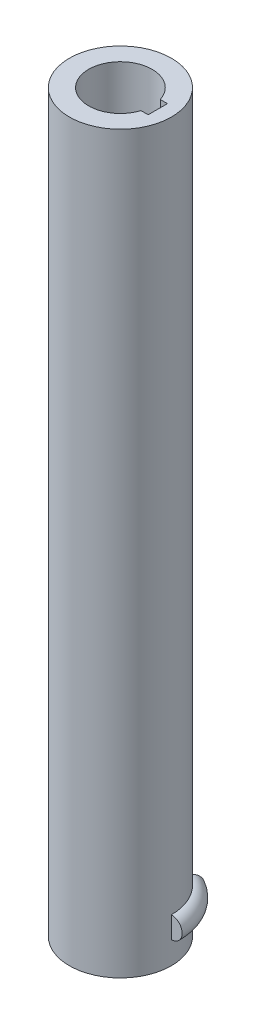
from build123d import *

# Parameters (mm, degrees)
REVOLVE_THIN1_ANGLE = 60
SKETCH3_R           = 45
BOSS_EXTRUDE2_DEPTH = 648.5
SKETCH4_R           = 28
CUT_EXTRUDE1_DEPTH  = 40
CUT_EXTRUDE2_DEPTH  = 40


# Read off the part's stored shape, not the designer's step: Revolve-Thin1
with BuildPart() as part:
    # Revolve-Thin1 outline → Revolve-Thin1 (revolve)
    with BuildSketch(Plane(origin=(-45, 0, 0), x_dir=(1, 0, 0), z_dir=(0, 0, 1))):
        with BuildLine():
            Line((35, -19.5), (0, -19.5))
            Line((0, -19.5), (0, -29.5))
            Line((0, -29.5), (45, -29.5))
            Line((45, -29.5), (45, -9.5))
            ThreePointArc((45, -9.5), (54.5, 0), (45, 9.5))
            Line((45, 9.5), (45, 619))
            Line((45, 619), (0, 619))
            Line((0, 619), (0, 609))
            Line((0, 609), (35, 609))
            Line((35, 609), (35, -19.5))
        make_face()
    revolve(axis=Axis((-45, 0, 0), (0, 1, 0)), revolution_arc=REVOLVE_THIN1_ANGLE)

    # Sketch3 → Boss-Extrude2 (add)
    with BuildSketch(Plane(origin=(0, 619, 0), x_dir=(1, 0, 0), z_dir=(0, 1, 0))):
        with Locations(Location((-45, 0, 0), (0, 0, 90))):
            Circle(SKETCH3_R)
    extrude(amount=-BOSS_EXTRUDE2_DEPTH)

    # Sketch4 → Cut-Extrude1 (cut)
    with BuildSketch(Plane(origin=(0, 619, 0), x_dir=(1, 0, 0), z_dir=(0, 1, 0))):
        with Locations(Location((-45, 0, 0), (0, 0, 270))):
            Circle(SKETCH4_R)
    extrude(amount=-CUT_EXTRUDE1_DEPTH, mode=Mode.SUBTRACT)

    # Sketch5 → Cut-Extrude2 (cut)
    with BuildSketch(Plane(origin=(0, 619, 0), x_dir=(1, 0, 0), z_dir=(0, 1, 0))):
        with BuildLine():
            Line((-18.321356856, 8.5), (-12, 8.5))
            Line((-12, 8.5), (-12, -8.5))
            Line((-12, -8.5), (-18.321356856, -8.5))
            ThreePointArc((-18.321356856, -8.5), (-17, 0), (-18.321356856, 8.5))
        make_face()
    extrude(amount=-CUT_EXTRUDE2_DEPTH, mode=Mode.SUBTRACT)


solid = part.part
